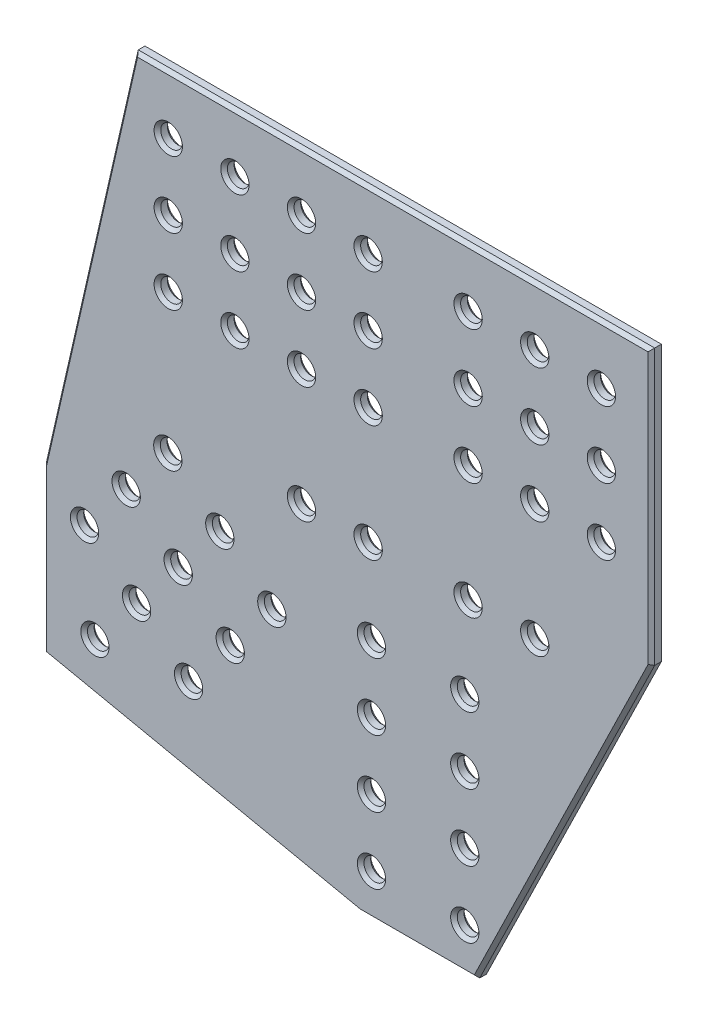
from build123d import *

# Parameters (mm, degrees)
SKETCH_1_R         = 13
EXTRUDE_1500_DEPTH = 16
CHAMFER_2_SIZE     = 4


with BuildPart() as part:
    # 草图1 → Extrude 1500 (new body)
    with BuildSketch(Plane.XY):
        Polygon((730, -330), (520, -760), (380, -760), (0, -680), (0, -482.786642105), (110, 0), (730, 0), align=None)
        with Locations((510, -70)):
            Circle(SKETCH_1_R, mode=Mode.SUBTRACT)
        with Locations((590, -70)):
            Circle(SKETCH_1_R, mode=Mode.SUBTRACT)
        with Locations((670, -70)):
            Circle(SKETCH_1_R, mode=Mode.SUBTRACT)
        with Locations((510, -150)):
            Circle(SKETCH_1_R, mode=Mode.SUBTRACT)
        with Locations((590, -150)):
            Circle(SKETCH_1_R, mode=Mode.SUBTRACT)
        with Locations((670, -150)):
            Circle(SKETCH_1_R, mode=Mode.SUBTRACT)
        with Locations((510, -230)):
            Circle(SKETCH_1_R, mode=Mode.SUBTRACT)
        with Locations((590, -230)):
            Circle(SKETCH_1_R, mode=Mode.SUBTRACT)
        with Locations((670, -230)):
            Circle(SKETCH_1_R, mode=Mode.SUBTRACT)
        with Locations((230, -230)):
            Circle(SKETCH_1_R, mode=Mode.SUBTRACT)
        with Locations((310, -230)):
            Circle(SKETCH_1_R, mode=Mode.SUBTRACT)
        with Locations((390, -230)):
            Circle(SKETCH_1_R, mode=Mode.SUBTRACT)
        with Locations((230, -150)):
            Circle(SKETCH_1_R, mode=Mode.SUBTRACT)
        with Locations((310, -150)):
            Circle(SKETCH_1_R, mode=Mode.SUBTRACT)
        with Locations((390, -150)):
            Circle(SKETCH_1_R, mode=Mode.SUBTRACT)
        with Locations((230, -70)):
            Circle(SKETCH_1_R, mode=Mode.SUBTRACT)
        with Locations((310, -70)):
            Circle(SKETCH_1_R, mode=Mode.SUBTRACT)
        with Locations((390, -70)):
            Circle(SKETCH_1_R, mode=Mode.SUBTRACT)
        with Locations((150, -70)):
            Circle(SKETCH_1_R, mode=Mode.SUBTRACT)
        with Locations((150, -150)):
            Circle(SKETCH_1_R, mode=Mode.SUBTRACT)
        with Locations((150, -230)):
            Circle(SKETCH_1_R, mode=Mode.SUBTRACT)
        with Locations((590, -370)):
            Circle(SKETCH_1_R, mode=Mode.SUBTRACT)
        with Locations((510, -370)):
            Circle(SKETCH_1_R, mode=Mode.SUBTRACT)
        with Locations((390, -370)):
            Circle(SKETCH_1_R, mode=Mode.SUBTRACT)
        with Locations((310, -370)):
            Circle(SKETCH_1_R, mode=Mode.SUBTRACT)
        with Locations((506, -470)):
            Circle(SKETCH_1_R, mode=Mode.SUBTRACT)
        with Locations((506, -550)):
            Circle(SKETCH_1_R, mode=Mode.SUBTRACT)
        with Locations((506, -630)):
            Circle(SKETCH_1_R, mode=Mode.SUBTRACT)
        with Locations((506, -710)):
            Circle(SKETCH_1_R, mode=Mode.SUBTRACT)
        with Locations((394, -710)):
            Circle(SKETCH_1_R, mode=Mode.SUBTRACT)
        with Locations((394, -630)):
            Circle(SKETCH_1_R, mode=Mode.SUBTRACT)
        with Locations((394, -550)):
            Circle(SKETCH_1_R, mode=Mode.SUBTRACT)
        with Locations((394, -470)):
            Circle(SKETCH_1_R, mode=Mode.SUBTRACT)
        with Locations((149.479377198, -397.484050539)):
            Circle(SKETCH_1_R, mode=Mode.SUBTRACT)
        with Locations((99.493096694, -459.945012437)):
            Circle(SKETCH_1_R, mode=Mode.SUBTRACT)
        with Locations((49.506816189, -522.405974336)):
            Circle(SKETCH_1_R, mode=Mode.SUBTRACT)
        with Locations((61.981497584, -634.85321674)):
            Circle(SKETCH_1_R, mode=Mode.SUBTRACT)
        with Locations((111.967778088, -572.392254841)):
            Circle(SKETCH_1_R, mode=Mode.SUBTRACT)
        with Locations((161.954058593, -509.931292942)):
            Circle(SKETCH_1_R, mode=Mode.SUBTRACT)
        with Locations((211.940339097, -447.470331043)):
            Circle(SKETCH_1_R, mode=Mode.SUBTRACT)
        with Locations((174.428739987, -622.378535345)):
            Circle(SKETCH_1_R, mode=Mode.SUBTRACT)
        with Locations((224.415020492, -559.917573446)):
            Circle(SKETCH_1_R, mode=Mode.SUBTRACT)
        with Locations((274.401300996, -497.456611548)):
            Circle(SKETCH_1_R, mode=Mode.SUBTRACT)
    extrude(amount=EXTRUDE_1500_DEPTH)

    # 倒角2
    chamfer_2_edges = [part.edges().sort_by_distance(p)[0] for p in [
        (381, -470, 0),
        (211.415020492, -559.917573446, 0),
        (198.940339097, -447.470331043, 0),
        (98.967778088, -572.392254841, 0),
        (36.506816189, -522.405974336, 0),
        (136.479377198, -397.484050539, 0),
        (381, -630, 0),
        (493, -710, 0),
        (493, -550, 0),
        (297, -370, 0),
        (497, -370, 0),
        (137, -230, 0),
        (137, -70, 0),
        (297, -70, 0),
        (377, -150, 0),
        (217, -150, 0),
        (297, -230, 0),
        (657, -230, 0),
        (497, -230, 0),
        (577, -150, 0),
        (657, -70, 0),
        (497, -70, 0),
        (420, 0, 0),
        (55, -241.393321053, 0),
        (0, -581.393321053, 0),
        (190, -720, 0),
        (450, -760, 0),
        (625, -545, 0),
        (730, -165, 0),
        (577, -70, 0),
        (497, -150, 0),
        (657, -150, 0),
        (577, -230, 0),
        (217, -230, 0),
        (377, -230, 0),
        (297, -150, 0),
        (217, -70, 0),
        (377, -70, 0),
        (137, -150, 0),
        (577, -370, 0),
        (377, -370, 0),
        (493, -470, 0),
        (493, -630, 0),
        (381, -710, 0),
        (381, -550, 0),
        (86.493096694, -459.945012437, 0),
        (48.981497584, -634.85321674, 0),
        (148.954058593, -509.931292942, 0),
        (161.428739987, -622.378535345, 0),
        (261.401300996, -497.456611548, 0),
        (381, -470, 16),
        (211.415020492, -559.917573446, 16),
        (198.940339097, -447.470331043, 16),
        (98.967778088, -572.392254841, 16),
        (36.506816189, -522.405974336, 16),
        (136.479377198, -397.484050539, 16),
        (381, -630, 16),
        (493, -710, 16),
        (493, -550, 16),
        (297, -370, 16),
        (497, -370, 16),
        (137, -230, 16),
        (137, -70, 16),
        (297, -70, 16),
        (377, -150, 16),
        (217, -150, 16),
        (297, -230, 16),
        (657, -230, 16),
        (497, -230, 16),
        (577, -150, 16),
        (657, -70, 16),
        (497, -70, 16),
        (625, -545, 16),
        (450, -760, 16),
        (190, -720, 16),
        (0, -581.393321053, 16),
        (55, -241.393321053, 16),
        (420, 0, 16),
        (730, -165, 16),
        (577, -70, 16),
        (497, -150, 16),
        (657, -150, 16),
        (577, -230, 16),
        (217, -230, 16),
        (377, -230, 16),
        (297, -150, 16),
        (217, -70, 16),
        (377, -70, 16),
        (137, -150, 16),
        (577, -370, 16),
        (377, -370, 16),
        (493, -470, 16),
        (493, -630, 16),
        (381, -710, 16),
        (381, -550, 16),
        (86.493096694, -459.945012437, 16),
        (48.981497584, -634.85321674, 16),
        (148.954058593, -509.931292942, 16),
        (161.428739987, -622.378535345, 16),
        (261.401300996, -497.456611548, 16),
    ]]
    chamfer(chamfer_2_edges, length=CHAMFER_2_SIZE)


solid = part.part
